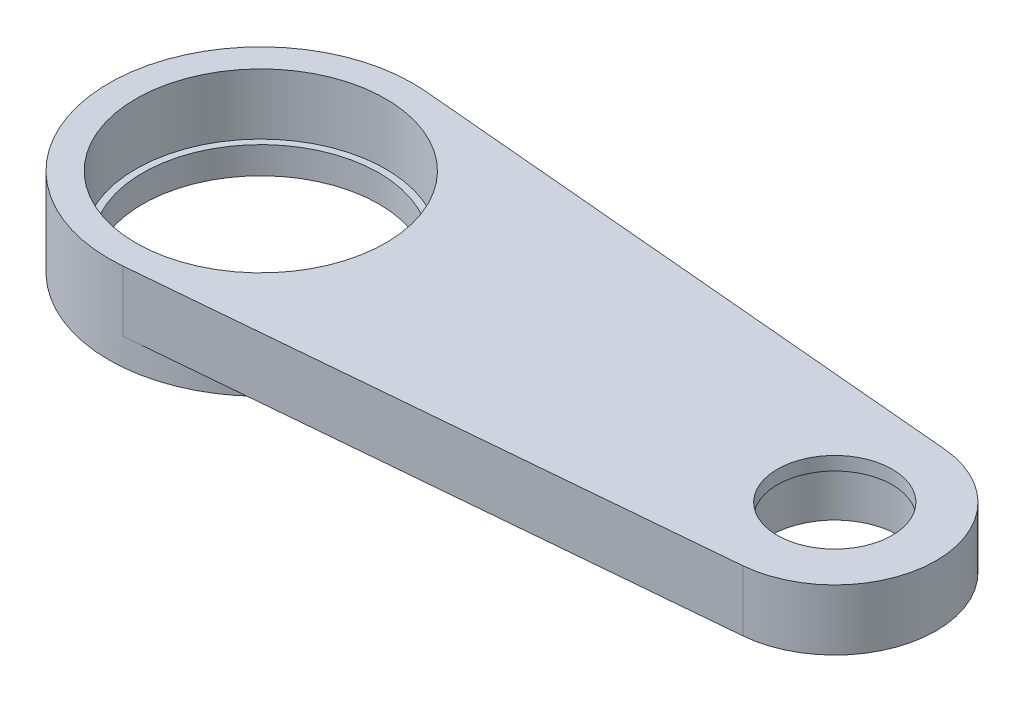
from build123d import *

# Parameters (mm, degrees)
SKETCH_1_R           = 22.5
SKETCH_1_R_2         = 17.5
EXTRUDE_1_DEPTH      = 8
SKETCH_2_R           = 22.5
SKETCH_2_R_2         = 18.5
EXTRUDE_2_DEPTH      = 5
EXTRUDE_START        = -9
EXTRUDE_3_DEPTH      = 9
CUT_EXTRUDE_START    = -4
SKETCH_7_R           = 18.5
CUT_EXTRUDE_4_DEPTH  = 4
SKETCH_13_R          = 9.5
CUT_EXTRUDE_9_DEPTH  = 7
SKETCH_14_R          = 8.5
CUT_EXTRUDE_10_DEPTH = 104.088554166


with BuildPart() as part:
    # 스케치1 → 보스-돌출1 (new body)
    with BuildSketch(Plane(origin=(0, 0, 0), x_dir=(1, 0, 0), z_dir=(0, 1, 0))):
        Circle(SKETCH_1_R)
        Circle(SKETCH_1_R_2, mode=Mode.SUBTRACT)
    extrude(amount=EXTRUDE_1_DEPTH)

    # 스케치2 → 보스-돌출2 (add)
    with BuildSketch(Plane(origin=(0, 8, 0), x_dir=(1, 0, 0), z_dir=(0, 1, 0))):
        Circle(SKETCH_2_R)
        Circle(SKETCH_2_R_2, mode=Mode.SUBTRACT)
    extrude(amount=EXTRUDE_2_DEPTH)

    # 스케치3 → 보스-돌출3 (add)
    with BuildSketch(Plane(origin=(0, 13, 0), x_dir=(1, 0, 0), z_dir=(0, 1, 0)).offset(EXTRUDE_START)):
        with BuildLine():
            Line((1.985294118, 22.412242352), (86.323529412, 14.941494902))
            ThreePointArc((86.323529412, 14.941494902), (100, 0), (86.323529412, -14.941494902))
            Line((86.323529412, -14.941494902), (1.985294118, -22.412242352))
            ThreePointArc((1.985294118, -22.412242352), (22.5, 0), (1.985294118, 22.412242352))
        make_face()
    extrude(amount=EXTRUDE_3_DEPTH)

    # 스케치7 → 컷-돌출4 (cut)
    with BuildSketch(Plane(origin=(0, 8, 0), x_dir=(1, 0, 0), z_dir=(0, 1, 0)).offset(CUT_EXTRUDE_START)):
        Circle(SKETCH_7_R)
    extrude(amount=CUT_EXTRUDE_4_DEPTH, mode=Mode.SUBTRACT)

    # 스케치13 → 컷-돌출9 (cut)
    with BuildSketch(Plane.XZ.offset(-4)):
        with Locations((85, 0)):
            Circle(SKETCH_13_R)
    extrude(amount=-CUT_EXTRUDE_9_DEPTH, mode=Mode.SUBTRACT)

    # 스케치14 → 컷-돌출10 (cut, through all)
    with BuildSketch(Plane.XZ.offset(-11)):
        with Locations((85, 0)):
            Circle(SKETCH_14_R)
    extrude(amount=-CUT_EXTRUDE_10_DEPTH, mode=Mode.SUBTRACT)


solid = part.part
